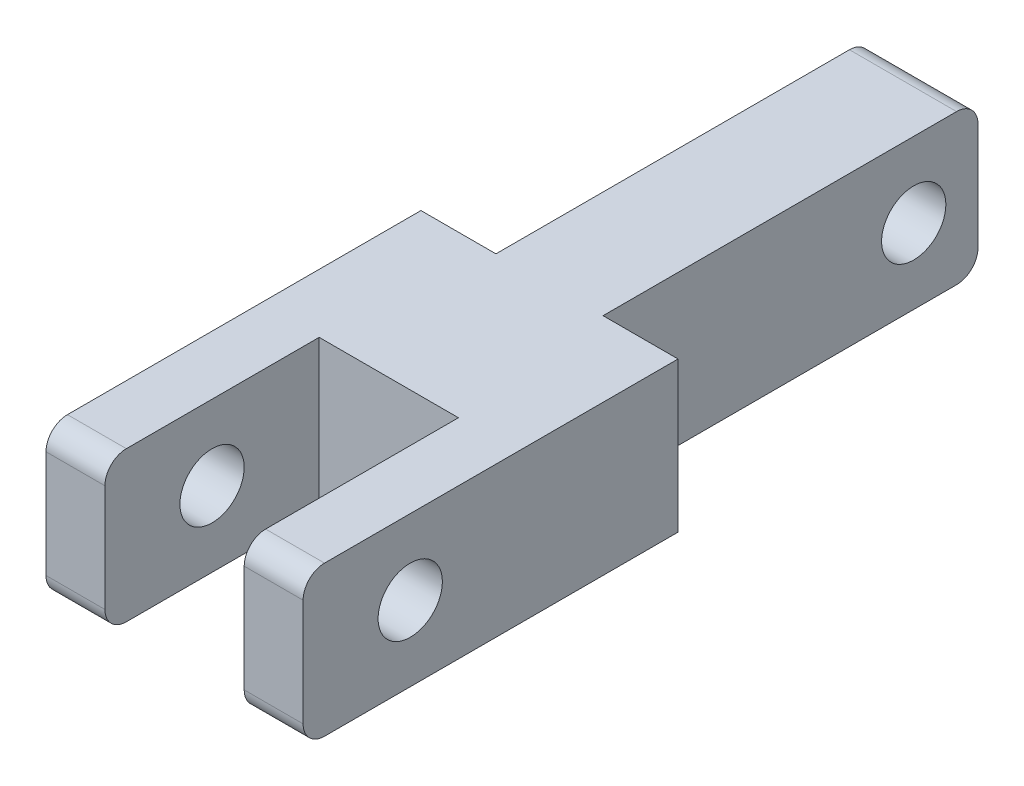
from build123d import *
from build123d.topology import SkipClean

# Parameters (mm, degrees)
SALIENTE_EXTRUIR1_DEPTH    = 2.5
CORTAR_EXTRUIR1_DEPTH      = 19.020821291
CORTAR_EXTRUIR1_DEPTH_BACK = 19.020821291
CROQUIS2_R                 = 1.5
CROQUIS3_R                 = 1.5
SALIENTE_EXTRUIR2_DEPTH    = 6
CORTAR_EXTRUIR2_DEPTH      = 3.25


with BuildPart() as part:
    # Croquis1 → Saliente-Extruir1 (new, symmetric)
    with BuildSketch(Plane(origin=(0, 0, 0), x_dir=(0, 0, -1), z_dir=(1, 0, 0))):
        with BuildLine():
            Line((-16.5, 3.5), (16.5, 3.5))
            ThreePointArc((16.5, 3.5), (17.207106781, 3.207106781), (17.5, 2.5))
            Line((17.5, 2.5), (17.5, -2.5))
            ThreePointArc((17.5, -2.5), (17.207106781, -3.207106781), (16.5, -3.5))
            Line((16.5, -3.5), (-16.5, -3.5))
            ThreePointArc((-16.5, -3.5), (-17.207106781, -3.207106781), (-17.5, -2.5))
            Line((-17.5, -2.5), (-17.5, 2.5))
            ThreePointArc((-17.5, 2.5), (-17.207106781, 3.207106781), (-16.5, 3.5))
        make_face()
    extrude(amount=SALIENTE_EXTRUIR1_DEPTH, both=True)

    # Croquis2 → Cortar-Extruir1 (cut, two sides: drawn at the far end of the back side and taken through both)
    with BuildSketch(Plane(origin=(0, 0, 0), x_dir=(0, 0, -1), z_dir=(1, 0, 0)).offset(-CORTAR_EXTRUIR1_DEPTH_BACK)):
        with Locations((-12.5, 0)):
            Circle(CROQUIS2_R)
        with Locations((14.5, 0)):
            Circle(CROQUIS2_R)
    extrude(amount=CORTAR_EXTRUIR1_DEPTH + CORTAR_EXTRUIR1_DEPTH_BACK, mode=Mode.SUBTRACT)

    # Croquis3 → Saliente-Extruir2 (add, symmetric)
    with SkipClean():  # the faces are left unmerged after this step: merging them gives an invalid solid
        with BuildSketch(Plane(origin=(0, 0, 0), x_dir=(0, 0, -1), z_dir=(1, 0, 0))):
            with BuildLine():
                Line((-17.5, 2.5), (-17.5, -2.5))
                ThreePointArc((-17.5, -2.5), (-17.207106781, -3.207106781), (-16.5, -3.5))
                Line((-16.5, -3.5), (0, -3.5))
                Line((0, -3.5), (0, 3.5))
                Line((0, 3.5), (-16.5, 3.5))
                ThreePointArc((-16.5, 3.5), (-17.207106781, 3.207106781), (-17.5, 2.5))
            make_face()
            with Locations((-12.5, 0)):
                Circle(CROQUIS3_R, mode=Mode.SUBTRACT)
        extrude(amount=SALIENTE_EXTRUIR2_DEPTH, both=True)
    add(part.part.scale(1), mode=Mode.REPLACE)  # the faces are merged on a copy

    # Croquis4 → Cortar-Extruir2 (cut, symmetric)
    with BuildSketch(Plane(origin=(0, 0, 0), x_dir=(0, 0, -1), z_dir=(1, 0, 0))):
        with BuildLine():
            Line((-16.5, 3.5), (-7.5, 3.5))
            Line((-7.5, 3.5), (-7.5, -3.5))
            Line((-7.5, -3.5), (-16.5, -3.5))
            ThreePointArc((-16.5, -3.5), (-17.207106781, -3.207106781), (-17.5, -2.5))
            Line((-17.5, -2.5), (-17.5, 2.5))
            ThreePointArc((-17.5, 2.5), (-17.207106781, 3.207106781), (-16.5, 3.5))
        make_face()
    extrude(amount=CORTAR_EXTRUIR2_DEPTH, both=True, mode=Mode.SUBTRACT)


solid = part.part
